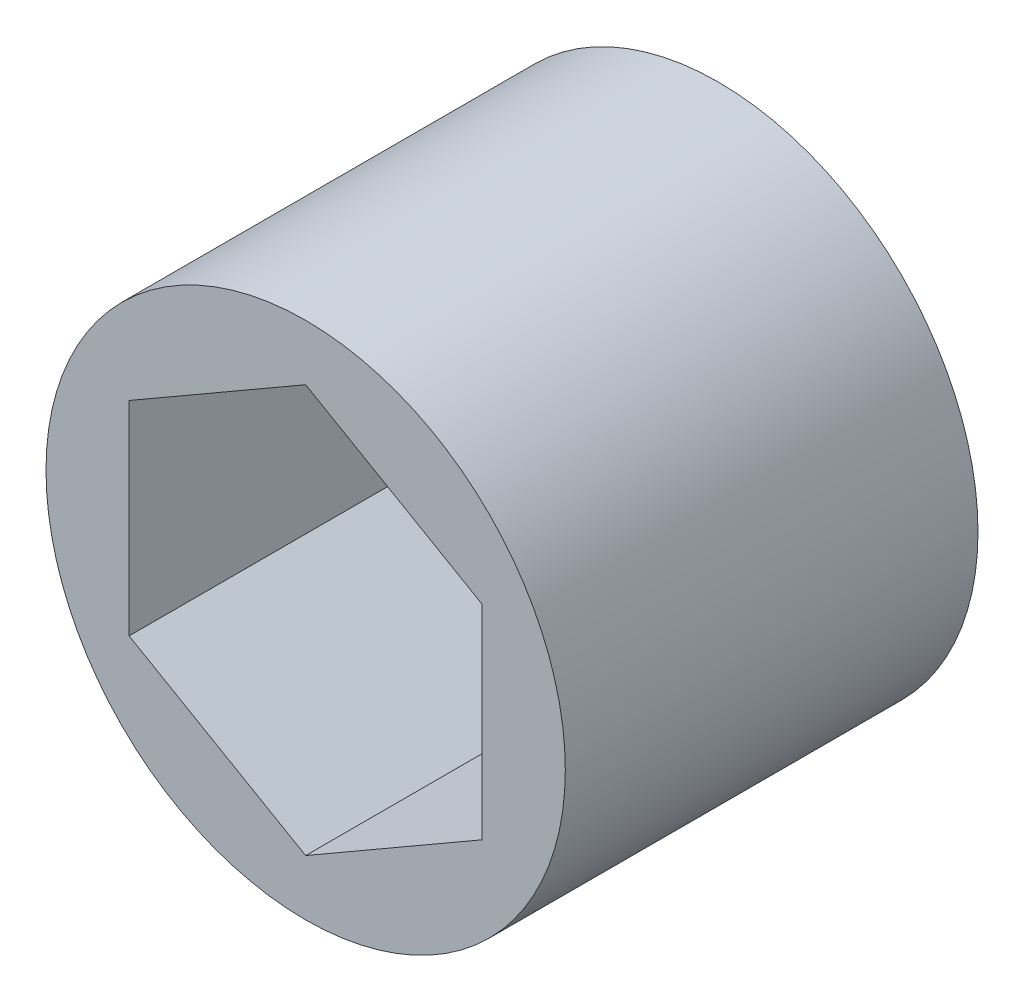
from build123d import *

# Parameters (mm, degrees)
SKETCH1_R           = 9.525
BOSS_EXTRUDE1_DEPTH = 7.5692


with BuildPart() as part:
    # Sketch1 → Boss-Extrude1 (new, symmetric)
    with BuildSketch(Plane.XY):
        Circle(SKETCH1_R)
        Polygon((0, 7.478995387), (-6.477, 3.739497694), (-6.477, -3.739497694), (0, -7.478995387), (6.477, -3.739497694), (6.477, 3.739497694), align=None, mode=Mode.SUBTRACT)
    extrude(amount=BOSS_EXTRUDE1_DEPTH, both=True)


solid = part.part
